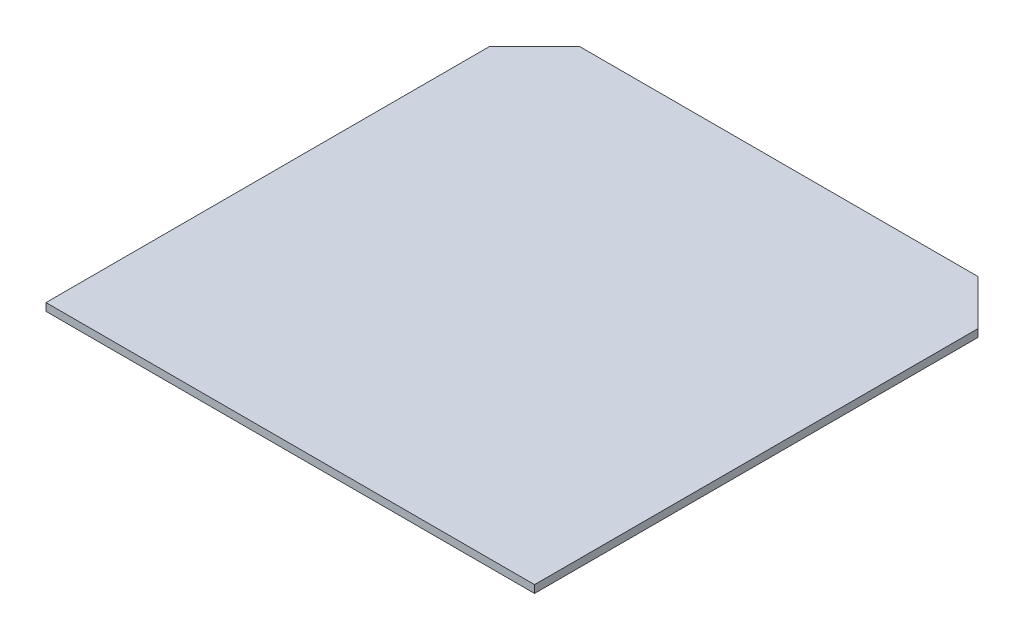
from build123d import *

# Parameters (mm, degrees)
SKETCH1_W           = 65
SKETCH1_H           = 65
BOSS_EXTRUDE1_DEPTH = 1.02
CHAMFER5_SIZE       = 6
CHAMFER6_SIZE       = 6


with BuildPart() as part:
    # Sketch1 → Boss-Extrude1 (new body)
    with BuildSketch(Plane(origin=(0, 0, 0), x_dir=(1, 0, 0), z_dir=(0, 1, 0))):
        Rectangle(SKETCH1_W, SKETCH1_H)
    extrude(amount=BOSS_EXTRUDE1_DEPTH)

    # Chamfer5
    chamfer5_edges = [part.edges().sort_by_distance(p)[0] for p in [
        (-32.5, 0.51, -32.5),
    ]]
    chamfer(chamfer5_edges, length=CHAMFER5_SIZE)

    # Chamfer6
    chamfer6_edges = [part.edges().sort_by_distance(p)[0] for p in [
        (32.5, 0.51, -32.5),
    ]]
    chamfer(chamfer6_edges, length=CHAMFER6_SIZE)


solid = part.part
